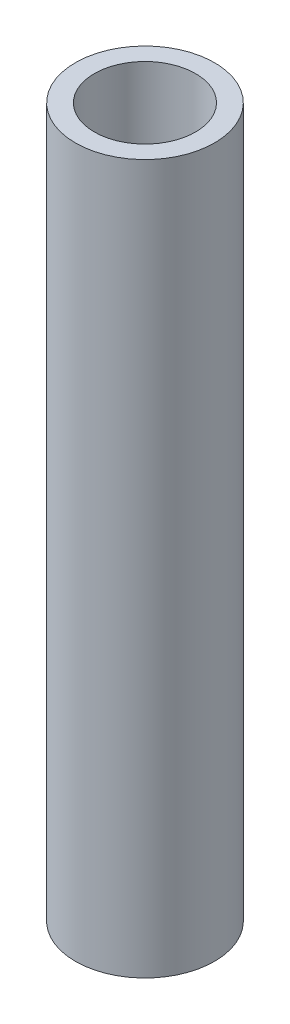
from build123d import *

# Parameters (mm, degrees)
SKETCH1_R           = 16.7005
SKETCH1_R_2         = 12.1539
BOSS_EXTRUDE1_DEPTH = 85.09


with BuildPart() as part:
    # Sketch1 → Boss-Extrude1 (new, symmetric)
    with BuildSketch(Plane(origin=(0, 0, 0), x_dir=(1, 0, 0), z_dir=(0, 1, 0))):
        Circle(SKETCH1_R)
        Circle(SKETCH1_R_2, mode=Mode.SUBTRACT)
    extrude(amount=BOSS_EXTRUDE1_DEPTH, both=True)


solid = part.part
